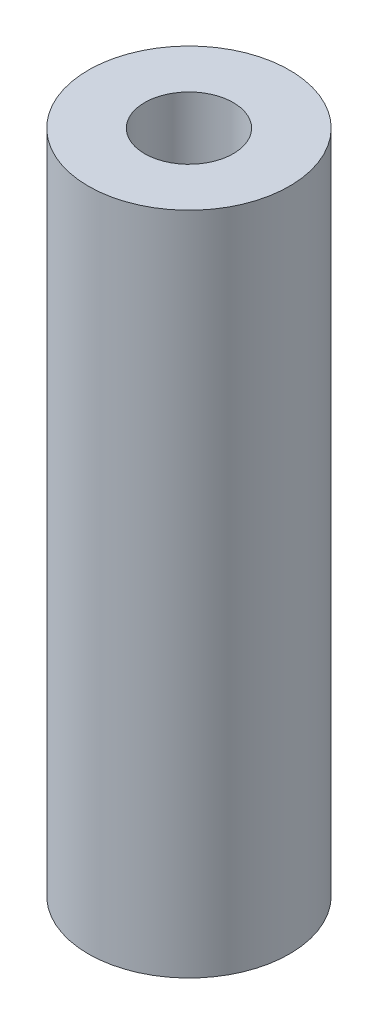
from build123d import *

# Parameters (mm, degrees)
SKETCH1_R           = 5.9
BOSS_EXTRUDE1_DEPTH = 39
SKETCH2_R           = 2.6
CUT_EXTRUDE1_DEPTH  = 4


with BuildPart() as part:
    # Sketch1 → Boss-Extrude1 (new body)
    with BuildSketch(Plane(origin=(0, 0, 0), x_dir=(1, 0, 0), z_dir=(0, 1, 0))):
        Circle(SKETCH1_R)
    extrude(amount=BOSS_EXTRUDE1_DEPTH)

    # Sketch2 → Cut-Extrude1 (cut)
    with BuildSketch(Plane(origin=(0, 39, 0), x_dir=(1, 0, 0), z_dir=(0, 1, 0))):
        Circle(SKETCH2_R)
    extrude(amount=-CUT_EXTRUDE1_DEPTH, mode=Mode.SUBTRACT)


solid = part.part
